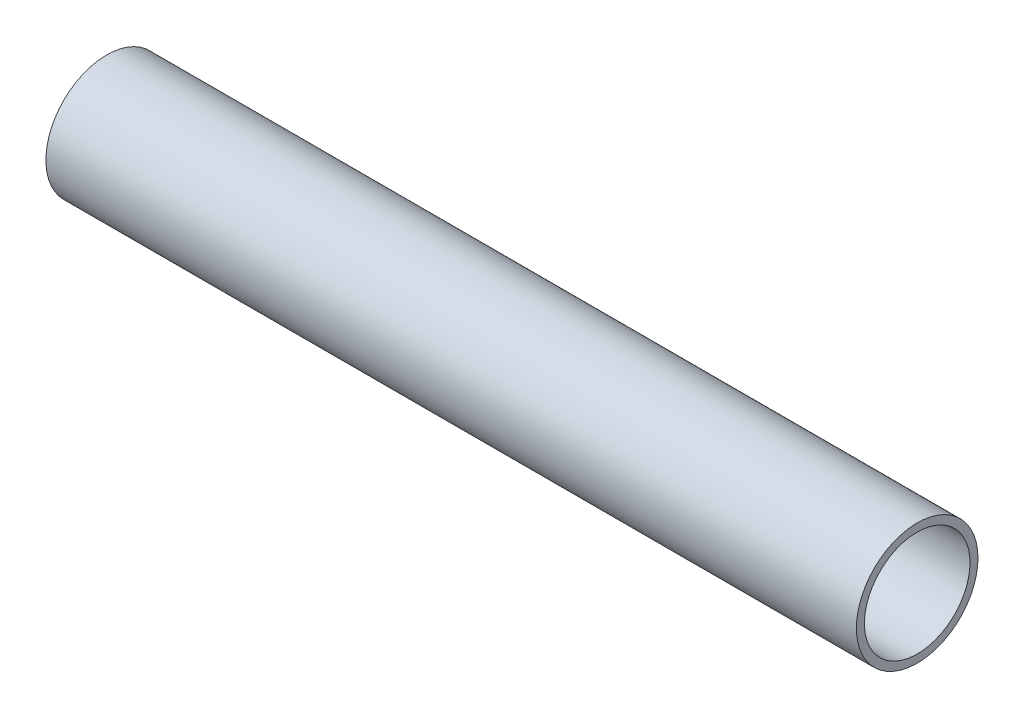
from build123d import *

# Parameters (mm, degrees)
SKETCH1_R           = 76.2
SKETCH1_R_2         = 66.2
BOSS_EXTRUDE1_DEPTH = 1016


with BuildPart() as part:
    # Sketch1 → Boss-Extrude1 (new body)
    with BuildSketch(Plane.YZ):
        Circle(SKETCH1_R)
        Circle(SKETCH1_R_2, mode=Mode.SUBTRACT)
    extrude(amount=BOSS_EXTRUDE1_DEPTH)


solid = part.part
